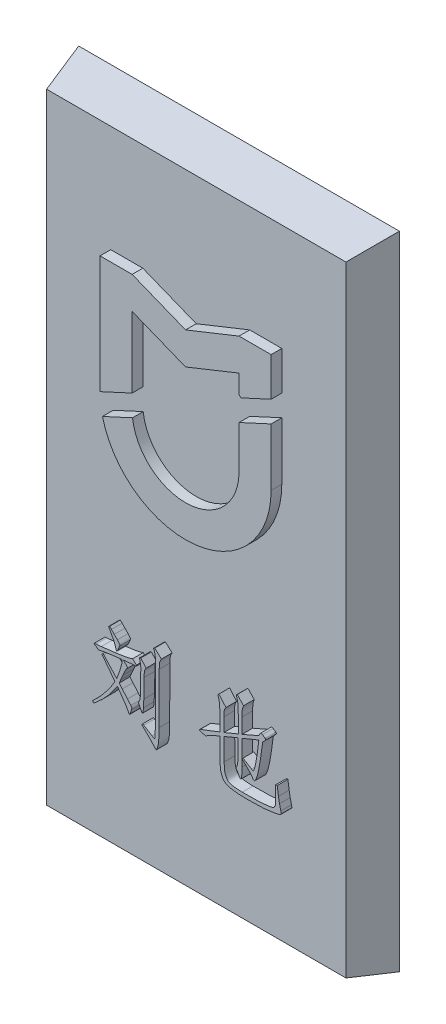
from build123d import *

# Parameters (mm, degrees)
EXTRUDE_2_DEPTH     = 1
EXTRUDE_3_DEPTH     = 1
SKETCH_5_R          = 5.5
CUT_EXTRUDE_1_DEPTH = 2
EXTRUDE_4_DEPTH     = 1


with BuildPart() as part:
    # 草图1 → 放样1 section 0
    with BuildSketch(Plane.XY):
        with BuildLine():
            Line((-15, -30), (15, -30))
            Line((15, -30), (15, 30))
            Line((15, 30), (-15, 30))
            Line((-15, 30), (-15, -30))
        make_face()
    # 草图2 → 放样1 section 1
    with BuildSketch(Plane.XY.offset(4)):
        with BuildLine():
            Line((-14, -29), (14, -29))
            Line((14, -29), (14, 29))
            Line((14, 29), (-14, 29))
            Line((-14, 29), (-14, -29))
        make_face()
    loft()

    # 草图3 → 凸台-拉伸2 (add)
    with BuildSketch(Plane.XY.offset(4)):
        with BuildLine():
            ThreePointArc((5, 8), (0.299928667, 3.009003827), (-4.964017118, 7.401222869))
            Line((-4.964017118, 7.401222869), (-7.772339179, 6.105074225))
            ThreePointArc((-7.772339179, 6.105074225), (0.954276315, 0.057119117), (8, 8))
            Line((8, 8), (8, 13.384615385))
            Line((8, 13.384615385), (5, 12))
            Line((5, 12), (5, 8))
        make_face()
        with BuildLine():
            Line((-5, 9.384615385), (-5, 16))
            Line((-5, 16), (0, 14))
            Line((0, 14), (5, 16))
            Line((5, 16), (5, 14.244997998))
            ThreePointArc((5, 14.244997998), (5.095728124, 14.167135063), (5.190243902, 14.087804878))
            Line((5.190243902, 14.087804878), (8, 15.384615385))
            Line((8, 15.384615385), (8, 19))
            Line((8, 19), (5, 19))
            Line((5, 19), (0, 17))
            Line((0, 17), (-5, 19))
            Line((-5, 19), (-8, 19))
            Line((-8, 19), (-8, 8))
            Line((-8, 8), (-5, 9.384615385))
        make_face()
    extrude(amount=EXTRUDE_2_DEPTH)

    # 草图4 → 凸台-拉伸3 (add)
    with BuildSketch(Plane.XY.offset(4)):
        with BuildLine():
            Line((-8.701981675, -17.388663968), (-8.617600682, -17.301725975))
            add(Edge.make_bspline(
                [(-8.617600682, -17.301725975), (-8.6150409, -17.299171838), (-8.607361553, -17.291509428), (-8.591939025, -17.275812111), (-8.567531532, -17.253359072), (-8.535647603, -17.222146979), (-8.494553267, -17.183979196), (-8.445204463, -17.138285053), (-8.386816782, -17.085481715), (-8.320576955, -17.024306793), (-8.246221878, -16.954193648), (-8.165436054, -16.873388622), (-8.079020214, -16.781225902), (-7.985588416, -16.679014982), (-7.886121691, -16.565894731), (-7.778094687, -16.443997551), (-7.666436292, -16.308719395), (-7.503591424, -16.115000087), (-7.298895179, -15.854174622), (-7.06301416, -15.517669226), (-6.830626913, -15.160132218), (-6.685534688, -14.909472229), (-6.611634349, -14.781802685)],
                knots=[0, 0, 0, 0, 0.067064899, 0.201194698, 0.408053647, 0.681959008, 1.028641223, 1.448132034, 1.929283414, 2.488604495, 3.120354818, 3.824536261, 4.607279378, 5.463251305, 6.392664243, 7.400870751, 8.483674113, 9.645406679, 12.094487374, 14.629448405, 17.264597856, 20, 20, 20, 20], degree=3))
            add(Edge.make_bspline(
                [(-6.611634349, -14.781802685), (-6.677355219, -14.694080325), (-6.801336137, -14.528594101), (-6.975046697, -14.293869871), (-7.128052851, -14.089741633), (-7.260480444, -13.915569528), (-7.369897523, -13.770279599), (-7.457376329, -13.654282983), (-7.526217285, -13.570571896), (-7.582699071, -13.497799136), (-7.635586412, -13.437186854), (-7.679234592, -13.378243521), (-7.712283472, -13.338932475), (-7.724576877, -13.315079833), (-7.729043256, -13.306413808)],
                knots=[0, 0, 0, 0, 2.13149326, 4.021013283, 5.678471046, 7.092298062, 8.275727547, 9.215558715, 9.917047241, 10.382981583, 11.006899411, 11.479347563, 11.810839116, 12, 12, 12, 12], degree=3))
            Line((-7.729043256, -13.306413808), (-7.824930748, -13.177285319))
            Line((-7.824930748, -13.177285319), (-7.729043256, -13.073726827))
            Line((-7.729043256, -13.073726827), (-7.644662263, -13.15938632))
            add(Edge.make_bspline(
                [(-7.644662263, -13.15938632), (-7.629282451, -13.175972122), (-7.591954382, -13.216227229), (-7.527305195, -13.288297956), (-7.440557184, -13.379422665), (-7.302378255, -13.536292511), (-7.104572099, -13.745740062), (-6.905065826, -13.963796689), (-6.747802954, -14.136718021), (-6.635049858, -14.252099447), (-6.536865705, -14.358806964), (-6.47286159, -14.423973045), (-6.442872363, -14.454506712)],
                knots=[0, 0, 0, 0, 0.384045172, 0.932109217, 1.643764177, 2.519898478, 4.481024401, 6.534588103, 7.538259206, 8.449228042, 9.273383417, 10, 10, 10, 10], degree=3))
            add(Edge.make_bspline(
                [(-6.442872363, -14.454506712), (-6.405201527, -14.35911478), (-6.332905522, -14.176043302), (-6.231843181, -13.912276932), (-6.149864716, -13.668866252), (-6.078665366, -13.450308489), (-6.024339358, -13.258168598), (-5.98424666, -13.096326335), (-5.956943752, -12.966798323), (-5.95252254, -12.890132643), (-5.950649904, -12.857660345)],
                knots=[0, 0, 0, 0, 1.468618142, 2.818499293, 4.043910366, 5.145864078, 6.10981738, 6.901638294, 7.534781031, 8, 8, 8, 8], degree=3))
            Line((-5.950649904, -12.857660345), (-5.950649904, -12.667163861))
            Line((-5.950649904, -12.667163861), (-6.972171319, -12.788621351))
            Line((-6.972171319, -12.788621351), (-7.451608779, -12.857660345))
            Line((-7.451608779, -12.857660345), (-7.956616237, -12.952269337))
            Line((-7.956616237, -12.952269337), (-8.16117622, -12.995738334))
            Line((-8.16117622, -12.995738334), (-8.232772214, -12.935648839))
            Line((-8.232772214, -12.935648839), (-8.485915193, -12.745152355))
            add(Edge.make_bspline(
                [(-8.485915193, -12.745152355), (-8.501489303, -12.73490888), (-8.526447886, -12.718493008), (-8.558458879, -12.694799587), (-8.557568147, -12.661889169), (-8.50827822, -12.649271695), (-8.449453901, -12.63496461), (-8.393937078, -12.628338983), (-8.365736203, -12.624973365)],
                knots=[0, 0, 0, 0, 1.118768377, 1.792903396, 2.169548065, 2.763492425, 4.355951528, 6, 6, 6, 6], degree=3))
            Line((-8.365736203, -12.624973365), (-7.885020243, -12.590453867))
            add(Edge.make_bspline(
                [(-7.885020243, -12.590453867), (-7.78272737, -12.578629672), (-7.574258285, -12.5545324), (-7.256024754, -12.515654208), (-6.925643087, -12.476441077), (-6.701543082, -12.448642762), (-6.587342851, -12.43447688)],
                knots=[0, 0, 0, 0, 0.945420497, 1.926731945, 2.943473063, 4, 4, 4, 4], degree=3))
            add(Edge.make_bspline(
                [(-6.587342851, -12.43447688), (-6.495657729, -12.423413493), (-6.318882537, -12.402082524), (-6.064664904, -12.364158296), (-5.830515798, -12.327688901), (-5.617264447, -12.28984122), (-5.424834911, -12.249462361), (-5.25244094, -12.211336739), (-5.101225844, -12.169009917), (-5.008293553, -12.13818563), (-4.964926486, -12.123801406)],
                knots=[0, 0, 0, 0, 1.33948248, 2.582613925, 3.727962399, 4.776813962, 5.723648299, 6.579883267, 7.337299279, 8, 8, 8, 8], degree=3))
            Line((-4.964926486, -12.123801406), (-4.592883017, -12.44342638))
            add(Edge.make_bspline(
                [(-4.592883017, -12.44342638), (-4.586313661, -12.454610374), (-4.573704208, -12.476077324), (-4.578676747, -12.511884126), (-4.596688819, -12.541911053), (-4.618071593, -12.545302265), (-4.628681014, -12.546984871)],
                knots=[0, 0, 0, 0, 1.123791349, 2.157044512, 3.08558681, 4, 4, 4, 4], degree=3))
            Line((-4.628681014, -12.546984871), (-5.193777967, -12.590453867))
            Line((-5.193777967, -12.590453867), (-5.793394417, -12.650543362))
            Line((-5.793394417, -12.650543362), (-5.409844449, -13.099296825))
            add(Edge.make_bspline(
                [(-5.409844449, -13.099296825), (-5.449499903, -13.136079122), (-5.524000558, -13.205181979), (-5.587303376, -13.301744233), (-5.61998484, -13.37159487), (-5.641445696, -13.416701743), (-5.666890063, -13.471734749), (-5.696865722, -13.536256466), (-5.729756683, -13.61142488), (-5.766306518, -13.697074488), (-5.809177744, -13.791622756), (-5.838230924, -13.858260359), (-5.853483912, -13.893245259)],
                knots=[0, 0, 0, 0, 1.762639404, 3.311468555, 3.728776672, 4.283189535, 4.943599157, 5.710021754, 6.607881863, 7.624557154, 8.752886879, 10, 10, 10, 10], degree=3))
            Line((-5.853483912, -13.893245259), (-6.082335393, -14.411037716))
            Line((-6.082335393, -14.411037716), (-6.214020882, -14.712763691))
            Line((-6.214020882, -14.712763691), (-5.926358406, -15.049009163))
            Line((-5.926358406, -15.049009163), (-5.434135947, -15.610270616))
            Line((-5.434135947, -15.610270616), (-5.120903473, -15.973364586))
            add(Edge.make_bspline(
                [(-5.120903473, -15.973364586), (-5.108508398, -15.990363114), (-5.086163173, -16.021007216), (-5.056993841, -16.062275096), (-5.040222812, -16.096032898), (-5.029672316, -16.123584455), (-5.031655384, -16.152962114), (-5.034721662, -16.189376311), (-5.04632312, -16.236994653), (-5.055631797, -16.272143528), (-5.060813978, -16.291711059)],
                knots=[0, 0, 0, 0, 1.455215602, 2.623390349, 3.479583614, 4.066449285, 4.626074215, 5.48479686, 6.599775501, 8, 8, 8, 8], degree=3))
            Line((-5.060813978, -16.291711059), (-5.169486469, -16.663754528))
            add(Edge.make_bspline(
                [(-5.169486469, -16.663754528), (-5.174174993, -16.677157718), (-5.18246774, -16.700864381), (-5.198745873, -16.729886481), (-5.216901029, -16.749122095), (-5.238951481, -16.755125572), (-5.261594893, -16.748983909), (-5.282282348, -16.729450325), (-5.305362329, -16.7015698), (-5.3182664, -16.677293999), (-5.325463456, -16.663754528)],
                knots=[0, 0, 0, 0, 1.365122435, 2.414536923, 3.199116316, 3.836643909, 4.513934304, 5.360547298, 6.527884014, 8, 8, 8, 8], degree=3))
            Line((-5.325463456, -16.663754528), (-5.421350948, -16.482207543))
            Line((-5.421350948, -16.482207543), (-5.565821436, -16.215001065))
            add(Edge.make_bspline(
                [(-5.565821436, -16.215001065), (-5.572208548, -16.205622117), (-5.588244401, -16.182074784), (-5.616983427, -16.140250866), (-5.658060685, -16.086621593), (-5.705063521, -16.017726276), (-5.763659301, -15.936783591), (-5.830878889, -15.842211073), (-5.90903839, -15.735248117), (-5.992876265, -15.619552174), (-6.075177782, -15.503789732), (-6.150436469, -15.397555707), (-6.216408063, -15.305904078), (-6.26928579, -15.226623912), (-6.312977006, -15.16243407), (-6.347040873, -15.11293019), (-6.368573488, -15.076247309), (-6.378991259, -15.056277349), (-6.382782868, -15.049009163)],
                knots=[0, 0, 0, 0, 0.382459276, 0.960224421, 1.710024245, 2.658454337, 3.770494442, 5.077894009, 6.569008607, 8.235429148, 9.893471766, 11.356158959, 12.623493842, 13.699131709, 14.567622413, 15.240873571, 15.723711415, 16, 16, 16, 16], degree=3))
            add(Edge.make_bspline(
                [(-6.382782868, -15.049009163), (-6.416909498, -15.100552505), (-6.482944033, -15.200288127), (-6.578062572, -15.345140635), (-6.670026744, -15.477861724), (-6.753098386, -15.60222334), (-6.833596009, -15.714430579), (-6.905249148, -15.8183162), (-6.973635526, -15.91004722), (-7.058115277, -16.023697045), (-7.173217897, -16.167150414), (-7.334311928, -16.346177935), (-7.520572626, -16.54609202), (-7.728276888, -16.75445262), (-7.936900177, -16.959762036), (-8.134192485, -17.142216407), (-8.308601908, -17.29845862), (-8.42121459, -17.389077999), (-8.473130194, -17.430854464)],
                knots=[0, 0, 0, 0, 0.931745548, 1.802914179, 2.611776586, 3.365396291, 4.056858392, 4.693065683, 5.267339538, 5.781210556, 6.827513186, 8.037874439, 9.410316573, 10.945546555, 12.471773758, 13.821678912, 14.99577158, 16, 16, 16, 16], degree=3))
            Line((-8.473130194, -17.430854464), (-8.606094183, -17.534412955))
            Line((-8.606094183, -17.534412955), (-8.701981675, -17.388663968))
        make_face()
        with BuildLine():
            Line((-7.211250799, -10.630513531), (-7.103856808, -10.553803537))
            Line((-7.103856808, -10.553803537), (-6.935094822, -10.726401023))
            Line((-6.935094822, -10.726401023), (-6.671723844, -10.993607501))
            Line((-6.671723844, -10.993607501), (-6.382782868, -11.295333475))
            add(Edge.make_bspline(
                [(-6.382782868, -11.295333475), (-6.364016122, -11.315776091), (-6.328925502, -11.354000303), (-6.279962873, -11.407778928), (-6.238808393, -11.454933426), (-6.206100395, -11.495820497), (-6.179781755, -11.528336484), (-6.163263547, -11.554924513), (-6.151359602, -11.573453422), (-6.145792904, -11.602262853), (-6.166926085, -11.650051026), (-6.181777032, -11.692273105), (-6.191007884, -11.71851694)],
                knots=[0, 0, 0, 0, 1.619185606, 3.027601398, 4.244025609, 5.269295413, 6.084975465, 6.67813271, 7.10086228, 7.354451259, 8.355615234, 10, 10, 10, 10], degree=3))
            Line((-6.191007884, -11.71851694), (-6.311186874, -12.029192414))
            add(Edge.make_bspline(
                [(-6.311186874, -12.029192414), (-6.321417975, -12.053246865), (-6.339637715, -12.096083488), (-6.369175367, -12.150574851), (-6.394959287, -12.188922038), (-6.420692917, -12.212351984), (-6.449964905, -12.215095714), (-6.472643068, -12.194654532), (-6.489438739, -12.160245395), (-6.497947711, -12.131683057), (-6.502961858, -12.114851907)],
                knots=[0, 0, 0, 0, 1.766026744, 3.144973943, 4.176047435, 4.895969722, 5.415113065, 5.991050895, 6.816171035, 8, 8, 8, 8], degree=3))
            Line((-6.502961858, -12.114851907), (-6.527253356, -12.029192414))
            add(Edge.make_bspline(
                [(-6.527253356, -12.029192414), (-6.565462786, -11.913018959), (-6.64149182, -11.681857287), (-6.749621634, -11.463861832), (-6.803409333, -11.35542297)],
                knots=[0, 0, 0, 0, 1.005127315, 2, 2, 2, 2], degree=3))
            Line((-6.803409333, -11.35542297), (-6.972171319, -11.053696996))
            add(Edge.make_bspline(
                [(-6.972171319, -11.053696996), (-6.993300524, -11.01673679), (-7.030051629, -10.952450019), (-7.07406915, -10.869103457), (-7.103723446, -10.815099763), (-7.112566488, -10.786565613), (-7.115363307, -10.777541019)],
                knots=[0, 0, 0, 0, 1.639141311, 2.851042099, 3.636615117, 4, 4, 4, 4], degree=3))
            Line((-7.115363307, -10.777541019), (-7.211250799, -10.630513531))
        make_face()
        with BuildLine():
            Line((-4.31544854, -11.727466439), (-4.19526955, -11.675047944))
            Line((-4.19526955, -11.675047944), (-3.691540592, -12.245258896))
            add(Edge.make_bspline(
                [(-3.691540592, -12.245258896), (-3.709810323, -12.2727357), (-3.743306609, -12.323112515), (-3.783569559, -12.394330478), (-3.813704395, -12.452101199), (-3.834694025, -12.516023227), (-3.847448468, -12.59699214), (-3.86001522, -12.684347934), (-3.866041286, -12.771519098), (-3.870153354, -12.858037951), (-3.87038165, -12.963355521), (-3.871309223, -13.040061953), (-3.871809077, -13.081397827)],
                knots=[0, 0, 0, 0, 1.131244594, 2.0740586, 2.806258543, 3.36096166, 4.37296763, 5.611338802, 6.388280779, 7.368648685, 8.582006723, 10, 10, 10, 10], degree=3))
            Line((-3.871809077, -13.081397827), (-3.907607074, -14.859791178))
            Line((-3.907607074, -14.859791178), (-3.943405071, -15.584700618))
            add(Edge.make_bspline(
                [(-3.943405071, -15.584700618), (-3.945337151, -15.617956796), (-3.948981312, -15.680682431), (-3.95706597, -15.768414138), (-3.964171003, -15.844825772), (-3.973350685, -15.90913213), (-3.981514107, -15.961795872), (-3.991691865, -16.002621639), (-4.002479425, -16.031402593), (-4.01557264, -16.054962993), (-4.04649104, -16.064029303), (-4.079703401, -16.034802266), (-4.114163474, -15.988274594), (-4.135459361, -15.945855862), (-4.147965054, -15.92094609)],
                knots=[0, 0, 0, 0, 1.76302463, 3.325302124, 4.663004508, 5.824175704, 6.762377734, 7.484540761, 8.041647273, 8.39829817, 8.869293458, 9.507688602, 10.536427081, 12, 12, 12, 12], degree=3))
            Line((-4.147965054, -15.92094609), (-4.255359045, -15.713829107))
            Line((-4.255359045, -15.713829107), (-4.352525037, -15.532282122))
            add(Edge.make_bspline(
                [(-4.352525037, -15.532282122), (-4.365405618, -15.507749536), (-4.386757968, -15.467081464), (-4.402824564, -15.412835847), (-4.395966719, -15.373877463), (-4.383846398, -15.34036551), (-4.365738625, -15.298101457), (-4.326896416, -15.231664451), (-4.282712631, -15.130473075), (-4.25294185, -14.987201603), (-4.235786887, -14.823160753), (-4.233540193, -14.705998092), (-4.232346047, -14.643724696)],
                knots=[0, 0, 0, 0, 0.901925096, 1.495136018, 1.774437093, 2.167492218, 2.649873968, 3.26160492, 4.659748266, 6.204185153, 7.982477734, 10, 10, 10, 10], degree=3))
            Line((-4.232346047, -14.643724696), (-4.19526955, -12.814191349))
            Line((-4.19526955, -12.814191349), (-4.183763051, -12.44342638))
            add(Edge.make_bspline(
                [(-4.183763051, -12.44342638), (-4.18831572, -12.402924774), (-4.198826597, -12.309417557), (-4.215744817, -12.184916485), (-4.235127336, -12.066005847), (-4.255291323, -11.96181072), (-4.282481032, -11.84759475), (-4.304121749, -11.768739449), (-4.31544854, -11.727466439)],
                knots=[0, 0, 0, 0, 1.006347927, 2.323384265, 3.101860361, 3.981004873, 4.943254252, 6, 6, 6, 6], degree=3))
        make_face()
        with BuildLine():
            Line((-2.886085659, -10.216279565), (-2.260899212, -10.795440017))
            add(Edge.make_bspline(
                [(-2.260899212, -10.795440017), (-2.27897721, -10.825593177), (-2.31186996, -10.88045657), (-2.353740762, -10.955684025), (-2.385079585, -11.013972945), (-2.406156719, -11.061201132), (-2.418307524, -11.107926684), (-2.429878104, -11.162874149), (-2.439530387, -11.231674601), (-2.451791638, -11.345356064), (-2.462447745, -11.509089806), (-2.464411029, -11.645623695), (-2.465459195, -11.71851694)],
                knots=[0, 0, 0, 0, 1.09355359, 1.989710599, 2.677512757, 3.152714002, 3.593377568, 4.175755165, 4.899414449, 5.752884475, 7.732533383, 10, 10, 10, 10], degree=3))
            Line((-2.465459195, -11.71851694), (-2.489750693, -16.464308545))
            add(Edge.make_bspline(
                [(-2.489750693, -16.464308545), (-2.489682191, -16.492009645), (-2.489529374, -16.553807072), (-2.490975351, -16.656519076), (-2.4938808, -16.778813349), (-2.496965577, -16.96890006), (-2.502164021, -17.223356379), (-2.509750918, -17.482641294), (-2.523924139, -17.690403365), (-2.543112578, -17.841690607), (-2.577602355, -17.986608757), (-2.61808336, -18.120197835), (-2.659407718, -18.233941254), (-2.695694125, -18.314965002), (-2.715146911, -18.36969669), (-2.735761473, -18.38529897), (-2.741615172, -18.389729384)],
                knots=[0, 0, 0, 0, 0.591697287, 1.319996994, 2.194077997, 3.204678908, 5.380780365, 7.630722164, 8.744310266, 9.828297922, 10.883818306, 11.920525732, 12.813365975, 13.454079988, 13.844980897, 14, 14, 14, 14], degree=3))
            add(Edge.make_bspline(
                [(-2.741615172, -18.389729384), (-2.748580604, -18.386552763), (-2.770203473, -18.376691542), (-2.805730246, -18.342781364), (-2.857676356, -18.290296374), (-2.898439287, -18.248716896), (-2.921883657, -18.224802898)],
                knots=[0, 0, 0, 0, 0.372665578, 1.156869871, 2.364803703, 4, 4, 4, 4], degree=3))
            Line((-2.921883657, -18.224802898), (-3.35529512, -17.750479437))
            Line((-3.35529512, -17.750479437), (-3.967696569, -17.154698487))
            Line((-3.967696569, -17.154698487), (-4.099382058, -17.008949499))
            Line((-4.099382058, -17.008949499), (-4.003494566, -16.905391008))
            Line((-4.003494566, -16.905391008), (-3.907607074, -16.974430002))
            Line((-3.907607074, -16.974430002), (-3.137950139, -17.448753463))
            add(Edge.make_bspline(
                [(-3.137950139, -17.448753463), (-3.107846641, -17.467453432), (-3.055614578, -17.499899429), (-2.987095797, -17.54194895), (-2.943047018, -17.562424533), (-2.912447329, -17.578564787), (-2.894380813, -17.563642034), (-2.884389813, -17.541037572), (-2.870955086, -17.507974371), (-2.865124564, -17.480861102), (-2.861794162, -17.465373961)],
                knots=[0, 0, 0, 0, 2.231975484, 3.872662471, 4.948167798, 5.447359977, 5.773533116, 6.264068126, 7.008433082, 8, 8, 8, 8], degree=3))
            add(Edge.make_bspline(
                [(-2.861794162, -17.465373961), (-2.858514906, -17.447512726), (-2.850750002, -17.405219364), (-2.858581596, -17.328530112), (-2.859413733, -17.227473124), (-2.851781312, -17.137658333), (-2.847727937, -17.0638988), (-2.843092015, -17.012428916), (-2.84163978, -16.949676316), (-2.836799089, -16.876886425), (-2.834870732, -16.792882265), (-2.832612814, -16.698680605), (-2.827953876, -16.593893276), (-2.826668572, -16.520567804), (-2.825996165, -16.482207543)],
                knots=[0, 0, 0, 0, 0.661127957, 1.565475392, 2.796625909, 4.357721855, 4.857348772, 5.497957161, 6.246587067, 7.151605532, 8.164975693, 9.318533995, 10.597189571, 12, 12, 12, 12], degree=3))
            Line((-2.825996165, -16.482207543), (-2.801704667, -11.545919455))
            add(Edge.make_bspline(
                [(-2.801704667, -11.545919455), (-2.801760094, -11.519481806), (-2.801871949, -11.466129504), (-2.807924708, -11.396797206), (-2.810607971, -11.332810947), (-2.815391131, -11.270252602), (-2.816801137, -11.193025953), (-2.822487079, -11.073272995), (-2.829012882, -10.921239192), (-2.843980556, -10.769848285), (-2.868264302, -10.646533474), (-2.89965208, -10.540449213), (-2.942670187, -10.417885881), (-2.976551583, -10.331655482), (-2.99475815, -10.28531856)],
                knots=[0, 0, 0, 0, 0.739991118, 1.493333668, 1.947445289, 2.533295858, 3.249720848, 4.109699155, 5.890394751, 7.51137051, 8.363279193, 9.405830689, 10.605992517, 12, 12, 12, 12], degree=3))
            Line((-2.99475815, -10.28531856), (-2.886085659, -10.216279565))
        make_face()
        with BuildLine():
            Line((3.210824632, -13.962284253), (3.210824632, -12.374387385))
            add(Edge.make_bspline(
                [(3.210824632, -12.374387385), (3.209126434, -12.271656981), (3.205655579, -12.06169196), (3.187606357, -11.795820456), (3.159876337, -11.575337912), (3.126662955, -11.402164237), (3.07905803, -11.224205556), (3.038507103, -11.105465778), (3.017771149, -11.044747496)],
                knots=[0, 0, 0, 0, 1.368881025, 2.797780605, 3.547867927, 4.328518173, 5.145277974, 6, 6, 6, 6], degree=3))
            Line((3.017771149, -11.044747496), (3.11493714, -10.941189005))
            Line((3.11493714, -10.941189005), (3.774643085, -11.700617942))
            add(Edge.make_bspline(
                [(3.774643085, -11.700617942), (3.758326503, -11.725251518), (3.72796582, -11.771087843), (3.687480246, -11.836093473), (3.657878594, -11.893945094), (3.627944587, -11.964767706), (3.607082509, -12.067445774), (3.592483254, -12.208639878), (3.584038135, -12.372591178), (3.583265573, -12.487741703), (3.582868101, -12.546984871)],
                knots=[0, 0, 0, 0, 0.799333978, 1.487341208, 2.069922442, 2.555870397, 3.562491356, 4.885176502, 6.397471374, 8, 8, 8, 8], degree=3))
            Line((3.582868101, -12.546984871), (3.582868101, -13.824206265))
            Line((3.582868101, -13.824206265), (4.929128489, -13.262944811))
            Line((4.929128489, -13.262944811), (4.929128489, -11.753036437))
            add(Edge.make_bspline(
                [(4.929128489, -11.753036437), (4.92858556, -11.691244836), (4.927548375, -11.573201294), (4.927892338, -11.404804507), (4.921425798, -11.253992254), (4.915833818, -11.079927224), (4.901987045, -10.885380488), (4.875754526, -10.70123617), (4.846282377, -10.559098647), (4.815991848, -10.44684633), (4.781186889, -10.325153143), (4.751489744, -10.242540414), (4.736075005, -10.199659067)],
                knots=[0, 0, 0, 0, 1.176911092, 2.248311282, 3.206600744, 4.051334116, 5.565261425, 6.918565952, 7.590320494, 8.328559244, 9.132414199, 10, 10, 10, 10], degree=3))
            Line((4.736075005, -10.199659067), (4.831962497, -10.112721074))
            Line((4.831962497, -10.112721074), (5.421350948, -10.734072022))
            add(Edge.make_bspline(
                [(5.421350948, -10.734072022), (5.408322526, -10.770211237), (5.383317544, -10.839571927), (5.351239432, -10.940628433), (5.325704556, -11.034024238), (5.303827308, -11.126182054), (5.29141719, -11.231984471), (5.283519325, -11.364266474), (5.276614903, -11.530086504), (5.276786754, -11.652026137), (5.27688046, -11.71851694)],
                knots=[0, 0, 0, 0, 0.919393691, 1.76455914, 2.536580374, 3.236881176, 4.028858006, 5.081856361, 6.408805183, 8, 8, 8, 8], degree=3))
            Line((5.27688046, -11.71851694), (5.27688046, -13.124866823))
            Line((5.27688046, -13.124866823), (6.827700831, -12.452375879))
            Line((6.827700831, -12.452375879), (7.019475815, -12.158320903))
            add(Edge.make_bspline(
                [(7.019475815, -12.158320903), (7.026703946, -12.148697104), (7.041507275, -12.128987408), (7.086030215, -12.128122667), (7.134752872, -12.147887327), (7.168626298, -12.170689347), (7.188237801, -12.183890901)],
                knots=[0, 0, 0, 0, 0.71453755, 1.463384476, 2.53139035, 4, 4, 4, 4], degree=3))
            Line((7.188237801, -12.183890901), (7.44010228, -12.374387385))
            add(Edge.make_bspline(
                [(7.44010228, -12.374387385), (7.456409708, -12.388950822), (7.484511329, -12.414047126), (7.499338251, -12.463386598), (7.482078066, -12.498937399), (7.458599113, -12.532898791), (7.416909429, -12.570821509), (7.368574387, -12.61700621), (7.316558293, -12.66066125), (7.273659526, -12.702873709), (7.241348343, -12.736242921), (7.21701738, -12.763028278), (7.208110051, -12.796607746), (7.197737652, -12.840710682), (7.1853454, -12.906928354), (7.171491916, -12.995155013), (7.156693918, -13.104841442), (7.138517192, -13.236055278), (7.117949326, -13.388985313), (7.090185505, -13.615805341), (7.057078191, -13.895783521), (7.012200307, -14.20829562), (6.973202819, -14.482784302), (6.930564858, -14.72147271), (6.891685116, -14.932838148), (6.854222441, -15.124032539), (6.8204412, -15.299942354), (6.785589875, -15.460139588), (6.75147321, -15.607093542), (6.714601925, -15.742081558), (6.673630702, -15.866106051), (6.630965981, -15.977511831), (6.590073801, -16.073390324), (6.556322534, -16.151155796), (6.52798116, -16.209509469), (6.502502392, -16.25649485), (6.470291137, -16.298824211), (6.434831686, -16.300083455), (6.418580865, -16.300660558)],
                knots=[0, 0, 0, 0, 0.559111769, 0.963484084, 1.199679221, 1.54642562, 2.027141703, 2.640108529, 3.269336219, 3.773372396, 4.184380251, 4.473866774, 4.681914613, 5.06490853, 5.645540527, 6.411685309, 7.363818343, 8.492742829, 9.820197465, 11.333935145, 14.372292433, 17.073622702, 19.457084914, 21.504944609, 23.311490023, 24.986709407, 26.517821523, 27.920066707, 29.204667356, 30.399106788, 31.519103026, 32.563782659, 33.467986644, 34.199448975, 34.748689143, 35.126785844, 35.59981199, 36, 36, 36, 36], degree=3))
            add(Edge.make_bspline(
                [(6.418580865, -16.300660558), (6.409816095, -16.299120895), (6.389730733, -16.2955926), (6.361018096, -16.272946221), (6.329957172, -16.239895489), (6.309607694, -16.212298734), (6.298401875, -16.197102067)],
                knots=[0, 0, 0, 0, 0.646680353, 1.481933883, 2.613379931, 4, 4, 4, 4], degree=3))
            Line((6.298401875, -16.197102067), (5.973662902, -15.791817601))
            Line((5.973662902, -15.791817601), (5.613125932, -15.421052632))
            Line((5.613125932, -15.421052632), (5.301171958, -15.126997656))
            Line((5.301171958, -15.126997656), (5.372767952, -14.997869167))
            Line((5.372767952, -14.997869167), (6.178222885, -15.490091626))
            add(Edge.make_bspline(
                [(6.178222885, -15.490091626), (6.194648608, -15.501452728), (6.223636396, -15.521502575), (6.263939359, -15.544300169), (6.292140741, -15.559916984), (6.316588627, -15.565606088), (6.337826073, -15.551900936), (6.356216812, -15.525312045), (6.377768277, -15.484375663), (6.405013145, -15.426588416), (6.435086831, -15.342078206), (6.466498512, -15.224546279), (6.505581258, -15.071791979), (6.559629335, -14.822391743), (6.627938588, -14.494438642), (6.679128713, -14.166876704), (6.712451994, -13.922564919), (6.736216622, -13.763771542), (6.754851776, -13.626833399), (6.773152012, -13.502512968), (6.791650807, -13.370998623), (6.808587871, -13.212279497), (6.829172257, -13.017111291), (6.843144072, -12.874717856), (6.850713829, -12.79757085)],
                knots=[0, 0, 0, 0, 0.440323242, 0.777073662, 1.016577932, 1.15873692, 1.297439592, 1.538046727, 1.870179391, 2.315683085, 2.945720451, 3.843830757, 4.996709113, 6.421182702, 9.468416178, 12.379641864, 13.726774567, 14.903855726, 15.918856624, 16.773102867, 17.673862327, 18.846135373, 20.291275087, 22, 22, 22, 22], degree=3))
            Line((6.850713829, -12.79757085), (5.265373961, -13.444491796))
            Line((5.265373961, -13.444491796), (5.265373961, -15.791817601))
            add(Edge.make_bspline(
                [(5.265373961, -15.791817601), (5.265651609, -15.854466389), (5.266174824, -15.972525423), (5.262737996, -16.139142222), (5.260821378, -16.284490155), (5.256968943, -16.408939518), (5.252241525, -16.512134297), (5.245890952, -16.594396297), (5.239366722, -16.655676085), (5.228165992, -16.706277228), (5.212924944, -16.748283526), (5.195840814, -16.782707572), (5.178343387, -16.807366528), (5.163005445, -16.808881042), (5.15670147, -16.809503516)],
                knots=[0, 0, 0, 0, 2.150659061, 4.052827516, 5.720942216, 7.140763154, 8.327264278, 9.266458778, 9.974179908, 10.439139188, 11.045371919, 11.490336149, 11.790525499, 12, 12, 12, 12], degree=3))
            add(Edge.make_bspline(
                [(5.15670147, -16.809503516), (5.145084644, -16.806090327), (5.115477873, -16.797391438), (5.079860637, -16.750467384), (5.03411576, -16.687163889), (5.00555075, -16.633226562), (4.989217984, -16.602386533)],
                knots=[0, 0, 0, 0, 0.521855015, 1.330005405, 2.473363152, 4, 4, 4, 4], degree=3))
            Line((4.989217984, -16.602386533), (4.831962497, -16.318559557))
            add(Edge.make_bspline(
                [(4.831962497, -16.318559557), (4.816647756, -16.292605327), (4.789719584, -16.24696956), (4.754513798, -16.187356703), (4.736850566, -16.14424678), (4.726676087, -16.112382083), (4.737698822, -16.086419896), (4.74847026, -16.055251845), (4.766358044, -16.014895421), (4.792389019, -15.966324018), (4.818368235, -15.903962994), (4.840282152, -15.826694947), (4.859466062, -15.734353684), (4.874221519, -15.632559334), (4.888087211, -15.531143226), (4.897628983, -15.441089287), (4.906229205, -15.367479809), (4.910466321, -15.300917129), (4.912987062, -15.222899108), (4.915654365, -15.115933767), (4.916598437, -14.970595453), (4.916435041, -14.861069343), (4.91634349, -14.799701683)],
                knots=[0, 0, 0, 0, 1.153316831, 2.027896723, 2.626604535, 2.958707876, 3.24723816, 3.664596661, 4.233327129, 4.925102638, 5.771803346, 6.807388563, 7.988979107, 9.373009111, 10.736290758, 11.899678417, 12.832920397, 13.567268629, 14.447137605, 15.815272531, 17.655290347, 20, 20, 20, 20], degree=3))
            Line((4.91634349, -14.799701683), (4.91634349, -13.582569785))
            Line((4.91634349, -13.582569785), (3.5943746, -14.134881739))
            Line((3.5943746, -14.134881739), (3.607159599, -16.188152568))
            add(Edge.make_bspline(
                [(3.607159599, -16.188152568), (3.609155134, -16.284053774), (3.613328035, -16.484594624), (3.628018181, -16.739684973), (3.658403283, -16.954775715), (3.708894856, -17.120409554), (3.779909349, -17.287863294), (3.8493934, -17.431707783), (3.937255351, -17.541708253), (4.041768254, -17.608686369), (4.174288903, -17.66793349), (4.339417769, -17.712353392), (4.53435378, -17.751593078), (4.762088112, -17.774427082), (5.02090097, -17.7920111), (5.204392162, -17.793279457), (5.301171958, -17.793948434)],
                knots=[0, 0, 0, 0, 1.425456696, 2.980799826, 3.795017339, 4.646697254, 5.544056949, 6.498866747, 7.011340332, 7.612152063, 8.320781704, 9.164607943, 10.145811148, 11.273905285, 12.562160463, 14, 14, 14, 14], degree=3))
            add(Edge.make_bspline(
                [(5.301171958, -17.793948434), (5.470789115, -17.794515515), (5.804503094, -17.79563122), (6.297213468, -17.787554868), (6.774213208, -17.772892278), (7.15857007, -17.752473046), (7.447605944, -17.73307115), (7.6382032, -17.714011088), (7.8043043, -17.691920919), (7.945776182, -17.664672643), (8.063545394, -17.637033396), (8.156964339, -17.603728141), (8.228035826, -17.569073121), (8.286855914, -17.514670336), (8.330260992, -17.44272668), (8.374041165, -17.363231496), (8.402674496, -17.284695978), (8.409655582, -17.232450653), (8.413040699, -17.207116983)],
                knots=[0, 0, 0, 0, 2.420504351, 4.762231322, 7.03186758, 9.2303889, 10.254712443, 11.165461446, 11.963621161, 12.644686658, 13.221420043, 13.686975695, 14.059747789, 14.339570671, 14.816933281, 15.24945927, 15.636064052, 16, 16, 16, 16], degree=3))
            Line((8.413040699, -17.207116983), (8.425825698, -15.635840614))
            Line((8.425825698, -15.635840614), (8.569017686, -15.619220115))
            Line((8.569017686, -15.619220115), (8.689196676, -16.438738547))
            Line((8.689196676, -16.438738547), (8.786362668, -16.991050501))
            Line((8.786362668, -16.991050501), (8.906541658, -17.508842958))
            add(Edge.make_bspline(
                [(8.906541658, -17.508842958), (8.908298872, -17.526376634), (8.912419079, -17.567488534), (8.928010183, -17.628304071), (8.946344796, -17.68162792), (8.951917027, -17.713778718), (8.953846154, -17.72490944)],
                knots=[0, 0, 0, 0, 0.953220718, 2.235054002, 3.388969388, 4, 4, 4, 4], degree=3))
            add(Edge.make_bspline(
                [(8.953846154, -17.72490944), (8.950069463, -17.736983143), (8.941712863, -17.763698363), (8.904645101, -17.795045339), (8.856434737, -17.82724415), (8.789371367, -17.855267017), (8.707715764, -17.884867177), (8.608460275, -17.912549262), (8.492372402, -17.939047729), (8.317130483, -17.971835273), (8.091894188, -18.009785756), (7.825098208, -18.045368552), (7.569274082, -18.078985841), (7.359310107, -18.098316431), (7.186183001, -18.110551033), (7.041252135, -18.117909869), (6.879727276, -18.124408997), (6.70198161, -18.128874983), (6.507684288, -18.134990279), (6.29669265, -18.136283727), (6.069134417, -18.139943667), (5.911870583, -18.139416346), (5.830470914, -18.139143405)],
                knots=[0, 0, 0, 0, 0.232926519, 0.515391414, 0.878795428, 1.325768791, 1.869100865, 2.508894764, 3.255029941, 4.101143149, 5.850638678, 7.536402802, 9.14670046, 10.687374927, 11.488261288, 12.400303648, 13.407749454, 14.51872378, 15.733519881, 17.051853478, 18.474041082, 20, 20, 20, 20], degree=3))
            add(Edge.make_bspline(
                [(5.830470914, -18.139143405), (5.749499846, -18.139378112), (5.591382586, -18.13983644), (5.360320443, -18.136582645), (5.141722252, -18.126795164), (4.935319262, -18.116184546), (4.741261185, -18.099891372), (4.559842862, -18.07740414), (4.390691678, -18.054235165), (4.234594957, -18.024596436), (4.091014932, -17.991286754), (3.960984602, -17.94893976), (3.843915713, -17.899325014), (3.74012297, -17.84200252), (3.649680107, -17.778015545), (3.572517953, -17.706759318), (3.509301087, -17.627469309), (3.447456445, -17.513961696), (3.388881158, -17.37449272), (3.328227496, -17.217719964), (3.287009221, -17.074340979), (3.260759296, -16.939508324), (3.249330552, -16.801128193), (3.240759072, -16.64807565), (3.233684411, -16.473317947), (3.233784497, -16.349677339), (3.233837631, -16.28404006)],
                knots=[0, 0, 0, 0, 1.518911959, 2.966074195, 4.334239857, 5.623327299, 6.842892953, 7.986185861, 9.05230548, 10.044787367, 10.965795675, 11.815222499, 12.606695946, 13.347450692, 14.035144098, 14.679960432, 15.31171039, 15.927477056, 17.09794899, 18.147758735, 19.078945764, 19.892674845, 20.719956626, 21.68090022, 22.768855931, 24, 24, 24, 24], degree=3))
            Line((3.233837631, -16.28404006), (3.222331131, -14.289580226))
            add(Edge.make_bspline(
                [(3.222331131, -14.289580226), (3.159695497, -14.315601661), (3.040781697, -14.365003374), (2.871626836, -14.434819669), (2.722994747, -14.499134877), (2.593460017, -14.553589381), (2.484240181, -14.601604607), (2.394031785, -14.640580012), (2.323583949, -14.672308254), (2.254988923, -14.705658648), (2.17860888, -14.74665373), (2.088638186, -14.806853655), (1.989717119, -14.87517737), (1.923522055, -14.927171092), (1.888855743, -14.95440017)],
                knots=[0, 0, 0, 0, 1.631833046, 3.098036258, 4.40260852, 5.528124467, 6.478632526, 7.272971962, 7.892419543, 8.33722278, 9.108053839, 9.975462267, 10.9397509, 12, 12, 12, 12], degree=3))
            Line((1.888855743, -14.95440017), (1.383848285, -14.816322182))
            add(Edge.make_bspline(
                [(1.383848285, -14.816322182), (1.371256566, -14.813541672), (1.349110971, -14.808651471), (1.321910173, -14.794053216), (1.302807026, -14.775950203), (1.297801439, -14.751917852), (1.303225753, -14.727242926), (1.321967909, -14.705700487), (1.34822781, -14.684206509), (1.37110556, -14.674629187), (1.383848285, -14.669294694)],
                knots=[0, 0, 0, 0, 1.286068791, 2.261864203, 3.078608935, 3.825212105, 4.613490036, 5.528387975, 6.623331777, 8, 8, 8, 8], degree=3))
            Line((1.383848285, -14.669294694), (3.210824632, -13.962284253))
        make_face()
    extrude(amount=EXTRUDE_3_DEPTH)

    # 草图5 → 切除-拉伸1 (cut)
    with BuildSketch(Plane(origin=(0, 0, 0), x_dir=(-1, 0, 0), z_dir=(0, 0, -1))):
        with Locations((0, 18)):
            Circle(SKETCH_5_R)
        with Locations((0, -18)):
            Circle(SKETCH_5_R)
        Circle(SKETCH_5_R)
    extrude(amount=-CUT_EXTRUDE_1_DEPTH, mode=Mode.SUBTRACT)

    # 草图7 → 凸台-拉伸4 (add)
    with BuildSketch(Plane.XY.offset(4)):
        with BuildLine():
            Line((3.210824632, -13.962284253), (1.383848285, -14.669294694))
            add(Edge.make_bspline(
                [(1.383848285, -14.669294694), (1.37110556, -14.674629187), (1.34822781, -14.684206509), (1.321967909, -14.705700487), (1.303225753, -14.727242926), (1.297801439, -14.751917852), (1.302807026, -14.775950203), (1.321910173, -14.794053216), (1.349110971, -14.808651471), (1.371256566, -14.813541672), (1.383848285, -14.816322182)],
                knots=[0, 0, 0, 0, 0.172083528, 0.308951503, 0.423313745, 0.521848487, 0.615173883, 0.717266975, 0.839241401, 1, 1, 1, 1], degree=3))
            Line((1.383848285, -14.816322182), (1.888855743, -14.95440017))
            add(Edge.make_bspline(
                [(1.888855743, -14.95440017), (1.923522055, -14.927171092), (1.989717119, -14.87517737), (2.088638186, -14.806853655), (2.17860888, -14.74665373), (2.254988923, -14.705658648), (2.323583949, -14.672308254), (2.394031785, -14.640580012), (2.484240181, -14.601604607), (2.593460017, -14.553589381), (2.722994747, -14.499134877), (2.871626836, -14.434819669), (3.040781697, -14.365003374), (3.159695497, -14.315601661), (3.222331131, -14.289580226)],
                knots=[0, 0, 0, 0, 0.088354092, 0.168711478, 0.240995513, 0.305231435, 0.342298371, 0.393919003, 0.460113956, 0.539322961, 0.633115957, 0.741830312, 0.864013913, 1, 1, 1, 1], degree=3))
            Line((3.222331131, -14.289580226), (3.233837631, -16.28404006))
            add(Edge.make_bspline(
                [(3.233837631, -16.28404006), (3.233784497, -16.349677339), (3.233684411, -16.473317947), (3.240759072, -16.64807565), (3.249330552, -16.801128193), (3.260759296, -16.939508324), (3.287009221, -17.074340979), (3.328227496, -17.217719964), (3.388881158, -17.37449272), (3.447456445, -17.513961696), (3.509301087, -17.627469309), (3.572517953, -17.706759318), (3.649680107, -17.778015545), (3.74012297, -17.84200252), (3.843915713, -17.899325014), (3.960984602, -17.94893976), (4.091014932, -17.991286754), (4.234594957, -18.024596436), (4.390691678, -18.054235165), (4.559842862, -18.07740414), (4.741261185, -18.099891372), (4.935319262, -18.116184546), (5.141722252, -18.126795164), (5.360320443, -18.136582645), (5.591382586, -18.13983644), (5.749499846, -18.139378112), (5.830470914, -18.139143405)],
                knots=[0, 0, 0, 0, 0.05129767, 0.096629158, 0.136668474, 0.171138548, 0.205043927, 0.243843386, 0.287585459, 0.336355123, 0.362012067, 0.388334982, 0.415202329, 0.443856221, 0.474721002, 0.507699063, 0.543091847, 0.581467193, 0.622820605, 0.667242256, 0.71487946, 0.765694696, 0.819406673, 0.876413575, 0.936712002, 1, 1, 1, 1], degree=3))
            add(Edge.make_bspline(
                [(5.830470914, -18.139143405), (5.911870583, -18.139416346), (6.069134417, -18.139943667), (6.29669265, -18.136283727), (6.507684288, -18.134990279), (6.70198161, -18.128874983), (6.879727276, -18.124408997), (7.041252135, -18.117909869), (7.186183001, -18.110551033), (7.359310107, -18.098316431), (7.569274082, -18.078985841), (7.825098208, -18.045368552), (8.091894188, -18.009785756), (8.317130483, -17.971835273), (8.492372402, -17.939047729), (8.608460275, -17.912549262), (8.707715764, -17.884867177), (8.789371367, -17.855267017), (8.856434737, -17.82724415), (8.904645101, -17.795045339), (8.941712863, -17.763698363), (8.950069463, -17.736983143), (8.953846154, -17.72490944)],
                knots=[0, 0, 0, 0, 0.076297946, 0.147407326, 0.213324006, 0.274063811, 0.329612527, 0.379984818, 0.425586936, 0.465631254, 0.542664977, 0.62317986, 0.707468066, 0.794942843, 0.837248503, 0.874555262, 0.906544957, 0.93371156, 0.956060229, 0.974230429, 0.988353674, 1, 1, 1, 1], degree=3))
            add(Edge.make_bspline(
                [(8.953846154, -17.72490944), (8.951917027, -17.713778718), (8.946344796, -17.68162792), (8.928010183, -17.628304071), (8.912419079, -17.567488534), (8.908298872, -17.526376634), (8.906541658, -17.508842958)],
                knots=[0, 0, 0, 0, 0.152757653, 0.4412365, 0.76169482, 1, 1, 1, 1], degree=3))
            Line((8.906541658, -17.508842958), (8.786362668, -16.991050501))
            Line((8.786362668, -16.991050501), (8.689196676, -16.438738547))
            Line((8.689196676, -16.438738547), (8.569017686, -15.619220115))
            Line((8.569017686, -15.619220115), (8.425825698, -15.635840614))
            Line((8.425825698, -15.635840614), (8.413040699, -17.207116983))
            add(Edge.make_bspline(
                [(8.413040699, -17.207116983), (8.409655582, -17.232450653), (8.402674496, -17.284695978), (8.374041165, -17.363231496), (8.330260992, -17.44272668), (8.286855914, -17.514670336), (8.228035826, -17.569073121), (8.156964339, -17.603728141), (8.063545394, -17.637033396), (7.945776182, -17.664672643), (7.8043043, -17.691920919), (7.6382032, -17.714011088), (7.447605944, -17.73307115), (7.15857007, -17.752473046), (6.774213208, -17.772892278), (6.297213468, -17.787554868), (5.804503094, -17.79563122), (5.470789115, -17.794515515), (5.301171958, -17.793948434)],
                knots=[0, 0, 0, 0, 0.022745997, 0.046908796, 0.07394167, 0.103776833, 0.121265763, 0.144564019, 0.173661247, 0.209707084, 0.252273677, 0.30215866, 0.359080472, 0.423100694, 0.560508276, 0.702360542, 0.848718478, 1, 1, 1, 1], degree=3))
            add(Edge.make_bspline(
                [(5.301171958, -17.793948434), (5.204392162, -17.793279457), (5.02090097, -17.7920111), (4.762088112, -17.774427082), (4.53435378, -17.751593078), (4.339417769, -17.712353392), (4.174288903, -17.66793349), (4.041768254, -17.608686369), (3.937255351, -17.541708253), (3.8493934, -17.431707783), (3.779909349, -17.287863294), (3.708894856, -17.120409554), (3.658403283, -16.954775715), (3.628018181, -16.739684973), (3.613328035, -16.484594624), (3.609155134, -16.284053774), (3.607159599, -16.188152568)],
                knots=[0, 0, 0, 0, 0.102702824, 0.194721051, 0.275299204, 0.345385147, 0.40565845, 0.456274853, 0.499189976, 0.535795232, 0.603995932, 0.668093053, 0.728927333, 0.787085727, 0.898181665, 1, 1, 1, 1], degree=3))
            Line((3.607159599, -16.188152568), (3.5943746, -14.134881739))
            Line((3.5943746, -14.134881739), (4.91634349, -13.582569785))
            Line((4.91634349, -13.582569785), (4.91634349, -14.799701683))
            add(Edge.make_bspline(
                [(4.91634349, -14.799701683), (4.916435041, -14.861069343), (4.916598437, -14.970595453), (4.915654365, -15.115933767), (4.912987062, -15.222899108), (4.910466321, -15.300917129), (4.906229205, -15.367479809), (4.897628983, -15.441089287), (4.888087211, -15.531143226), (4.874221519, -15.632559334), (4.859466062, -15.734353684), (4.840282152, -15.826694947), (4.818368235, -15.903962994), (4.792389019, -15.966324018), (4.766358044, -16.014895421), (4.74847026, -16.055251845), (4.737698822, -16.086419896), (4.726676087, -16.112382083), (4.736850566, -16.14424678), (4.754513798, -16.187356703), (4.789719584, -16.24696956), (4.816647756, -16.292605327), (4.831962497, -16.318559557)],
                knots=[0, 0, 0, 0, 0.117235483, 0.209236373, 0.27764312, 0.321636569, 0.35835398, 0.405016079, 0.463185462, 0.531349544, 0.600551045, 0.659630572, 0.711409833, 0.753744868, 0.788333644, 0.816770167, 0.837638092, 0.852064606, 0.868669773, 0.898605164, 0.942334158, 1, 1, 1, 1], degree=3))
            Line((4.831962497, -16.318559557), (4.989217984, -16.602386533))
            add(Edge.make_bspline(
                [(4.989217984, -16.602386533), (5.00555075, -16.633226562), (5.03411576, -16.687163889), (5.079860637, -16.750467384), (5.115477873, -16.797391438), (5.145084644, -16.806090327), (5.15670147, -16.809503516)],
                knots=[0, 0, 0, 0, 0.381659212, 0.667498649, 0.869536246, 1, 1, 1, 1], degree=3))
            add(Edge.make_bspline(
                [(5.15670147, -16.809503516), (5.163005445, -16.808881042), (5.178343387, -16.807366528), (5.195840814, -16.782707572), (5.212924944, -16.748283526), (5.228165992, -16.706277228), (5.239366722, -16.655676085), (5.245890952, -16.594396297), (5.252241525, -16.512134297), (5.256968943, -16.408939518), (5.260821378, -16.284490155), (5.262737996, -16.139142222), (5.266174824, -15.972525423), (5.265651609, -15.854466389), (5.265373961, -15.791817601)],
                knots=[0, 0, 0, 0, 0.017456208, 0.042471988, 0.07955234, 0.130071734, 0.168818341, 0.227795102, 0.30606131, 0.404936404, 0.523254815, 0.662264374, 0.820778412, 1, 1, 1, 1], degree=3))
            Line((5.265373961, -15.791817601), (5.265373961, -13.444491796))
            Line((5.265373961, -13.444491796), (6.850713829, -12.79757085))
            add(Edge.make_bspline(
                [(6.850713829, -12.79757085), (6.843144072, -12.874717856), (6.829172257, -13.017111291), (6.808587871, -13.212279497), (6.791650807, -13.370998623), (6.773152012, -13.502512968), (6.754851776, -13.626833399), (6.736216622, -13.763771542), (6.712451994, -13.922564919), (6.679128713, -14.166876704), (6.627938588, -14.494438642), (6.559629335, -14.822391743), (6.505581258, -15.071791979), (6.466498512, -15.224546279), (6.435086831, -15.342078206), (6.405013145, -15.426588416), (6.377768277, -15.484375663), (6.356216812, -15.525312045), (6.337826073, -15.551900936), (6.316588627, -15.565606088), (6.292140741, -15.559916984), (6.263939359, -15.544300169), (6.223636396, -15.521502575), (6.194648608, -15.501452728), (6.178222885, -15.490091626)],
                knots=[0, 0, 0, 0, 0.077669314, 0.143357483, 0.196642622, 0.237586233, 0.276415608, 0.322552012, 0.376055701, 0.437289006, 0.569617446, 0.708128059, 0.772876858, 0.82528042, 0.866103616, 0.894741678, 0.914991846, 0.930088785, 0.941025473, 0.94733014, 0.953791912, 0.96467847, 0.979985307, 1, 1, 1, 1], degree=3))
            Line((6.178222885, -15.490091626), (5.372767952, -14.997869167))
            Line((5.372767952, -14.997869167), (5.301171958, -15.126997656))
            Line((5.301171958, -15.126997656), (5.613125932, -15.421052632))
            Line((5.613125932, -15.421052632), (5.973662902, -15.791817601))
            Line((5.973662902, -15.791817601), (6.298401875, -16.197102067))
            add(Edge.make_bspline(
                [(6.298401875, -16.197102067), (6.309607694, -16.212298734), (6.329957172, -16.239895489), (6.361018096, -16.272946221), (6.389730733, -16.2955926), (6.409816095, -16.299120895), (6.418580865, -16.300660558)],
                knots=[0, 0, 0, 0, 0.346655017, 0.629516529, 0.838329912, 1, 1, 1, 1], degree=3))
            add(Edge.make_bspline(
                [(6.418580865, -16.300660558), (6.434831686, -16.300083455), (6.470291137, -16.298824211), (6.502502392, -16.25649485), (6.52798116, -16.209509469), (6.556322534, -16.151155796), (6.590073801, -16.073390324), (6.630965981, -15.977511831), (6.673630702, -15.866106051), (6.714601925, -15.742081558), (6.75147321, -15.607093542), (6.785589875, -15.460139588), (6.8204412, -15.299942354), (6.854222441, -15.124032539), (6.891685116, -14.932838148), (6.930564858, -14.72147271), (6.973202819, -14.482784302), (7.012200307, -14.20829562), (7.057078191, -13.895783521), (7.090185505, -13.615805341), (7.117949326, -13.388985313), (7.138517192, -13.236055278), (7.156693918, -13.104841442), (7.171491916, -12.995155013), (7.1853454, -12.906928354), (7.197737652, -12.840710682), (7.208110051, -12.796607746), (7.21701738, -12.763028278), (7.241348343, -12.736242921), (7.273659526, -12.702873709), (7.316558293, -12.66066125), (7.368574387, -12.61700621), (7.416909429, -12.570821509), (7.458599113, -12.532898791), (7.482078066, -12.498937399), (7.499338251, -12.463386598), (7.484511329, -12.414047126), (7.456409708, -12.388950822), (7.44010228, -12.374387385)],
                knots=[0, 0, 0, 0, 0.011116334, 0.024255949, 0.034758635, 0.050015306, 0.070333704, 0.095450482, 0.12446936, 0.155580367, 0.18875924, 0.224442591, 0.263393847, 0.305924739, 0.35245861, 0.402640428, 0.459525419, 0.525732703, 0.600769655, 0.685168468, 0.727216737, 0.764090477, 0.79544949, 0.82189763, 0.84317943, 0.859308096, 0.869946816, 0.875725923, 0.883767215, 0.8951841, 0.909185105, 0.926663652, 0.943690508, 0.957043733, 0.966675577, 0.973236553, 0.984469118, 1, 1, 1, 1], degree=3))
            Line((7.44010228, -12.374387385), (7.188237801, -12.183890901))
            add(Edge.make_bspline(
                [(7.188237801, -12.183890901), (7.168626298, -12.170689347), (7.134752872, -12.147887327), (7.086030215, -12.128122667), (7.041507275, -12.128987408), (7.026703946, -12.148697104), (7.019475815, -12.158320903)],
                knots=[0, 0, 0, 0, 0.367152412, 0.634153881, 0.821365613, 1, 1, 1, 1], degree=3))
            Line((7.019475815, -12.158320903), (6.827700831, -12.452375879))
            Line((6.827700831, -12.452375879), (5.27688046, -13.124866823))
            Line((5.27688046, -13.124866823), (5.27688046, -11.71851694))
            add(Edge.make_bspline(
                [(5.27688046, -11.71851694), (5.276786754, -11.652026137), (5.276614903, -11.530086504), (5.283519325, -11.364266474), (5.29141719, -11.231984471), (5.303827308, -11.126182054), (5.325704556, -11.034024238), (5.351239432, -10.940628433), (5.383317544, -10.839571927), (5.408322526, -10.770211237), (5.421350948, -10.734072022)],
                knots=[0, 0, 0, 0, 0.198899352, 0.364767955, 0.496392749, 0.595389853, 0.682927453, 0.779430108, 0.885075789, 1, 1, 1, 1], degree=3))
            Line((5.421350948, -10.734072022), (4.831962497, -10.112721074))
            Line((4.831962497, -10.112721074), (4.736075005, -10.199659067))
            add(Edge.make_bspline(
                [(4.736075005, -10.199659067), (4.751489744, -10.242540414), (4.781186889, -10.325153143), (4.815991848, -10.44684633), (4.846282377, -10.559098647), (4.875754526, -10.70123617), (4.901987045, -10.885380488), (4.915833818, -11.079927224), (4.921425798, -11.253992254), (4.927892338, -11.404804507), (4.927548375, -11.573201294), (4.92858556, -11.691244836), (4.929128489, -11.753036437)],
                knots=[0, 0, 0, 0, 0.08675858, 0.167144076, 0.240967951, 0.308143405, 0.443473858, 0.594866588, 0.679339926, 0.775168872, 0.882308891, 1, 1, 1, 1], degree=3))
            Line((4.929128489, -11.753036437), (4.929128489, -13.262944811))
            Line((4.929128489, -13.262944811), (3.582868101, -13.824206265))
            Line((3.582868101, -13.824206265), (3.582868101, -12.546984871))
            add(Edge.make_bspline(
                [(3.582868101, -12.546984871), (3.583265573, -12.487741703), (3.584038135, -12.372591178), (3.592483254, -12.208639878), (3.607082509, -12.067445774), (3.627944587, -11.964767706), (3.657878594, -11.893945094), (3.687480246, -11.836093473), (3.72796582, -11.771087843), (3.758326503, -11.725251518), (3.774643085, -11.700617942)],
                knots=[0, 0, 0, 0, 0.200316078, 0.389352937, 0.554688581, 0.6805162, 0.741259695, 0.814082349, 0.900083253, 1, 1, 1, 1], degree=3))
            Line((3.774643085, -11.700617942), (3.11493714, -10.941189005))
            Line((3.11493714, -10.941189005), (3.017771149, -11.044747496))
            add(Edge.make_bspline(
                [(3.017771149, -11.044747496), (3.038507103, -11.105465778), (3.07905803, -11.224205556), (3.126662955, -11.402164237), (3.159876337, -11.575337912), (3.187606357, -11.795820456), (3.205655579, -12.06169196), (3.209126434, -12.271656981), (3.210824632, -12.374387385)],
                knots=[0, 0, 0, 0, 0.142453671, 0.278580305, 0.408688679, 0.533703232, 0.771853163, 1, 1, 1, 1], degree=3))
            Line((3.210824632, -12.374387385), (3.210824632, -13.962284253))
        make_face()
        with BuildLine():
            Line((-2.886085659, -10.216279565), (-2.99475815, -10.28531856))
            add(Edge.make_bspline(
                [(-2.99475815, -10.28531856), (-2.976551583, -10.331655482), (-2.942670187, -10.417885881), (-2.89965208, -10.540449213), (-2.868264302, -10.646533474), (-2.843980556, -10.769848285), (-2.829012882, -10.921239192), (-2.822487079, -11.073272995), (-2.816801137, -11.193025953), (-2.815391131, -11.270252602), (-2.810607971, -11.332810947), (-2.807924708, -11.396797206), (-2.801871949, -11.466129504), (-2.801760094, -11.519481806), (-2.801704667, -11.545919455)],
                knots=[0, 0, 0, 0, 0.11616729, 0.216180776, 0.303060067, 0.374052457, 0.509133771, 0.65752507, 0.729189929, 0.788892012, 0.837712893, 0.875555528, 0.938334073, 1, 1, 1, 1], degree=3))
            Line((-2.801704667, -11.545919455), (-2.825996165, -16.482207543))
            add(Edge.make_bspline(
                [(-2.825996165, -16.482207543), (-2.826668572, -16.520567804), (-2.827953876, -16.593893276), (-2.832612814, -16.698680605), (-2.834870732, -16.792882265), (-2.836799089, -16.876886425), (-2.84163978, -16.949676316), (-2.843092015, -17.012428916), (-2.847727937, -17.0638988), (-2.851781312, -17.137658333), (-2.859413733, -17.227473124), (-2.858581596, -17.328530112), (-2.850750002, -17.405219364), (-2.858514906, -17.447512726), (-2.861794162, -17.465373961)],
                knots=[0, 0, 0, 0, 0.116900869, 0.2234555, 0.319585359, 0.404032872, 0.479451078, 0.541836903, 0.595220936, 0.636856512, 0.766947841, 0.869543717, 0.944906004, 1, 1, 1, 1], degree=3))
            add(Edge.make_bspline(
                [(-2.861794162, -17.465373961), (-2.865124564, -17.480861102), (-2.870955086, -17.507974371), (-2.884389813, -17.541037572), (-2.894380813, -17.563642034), (-2.912447329, -17.578564787), (-2.943047018, -17.562424533), (-2.987095797, -17.54194895), (-3.055614578, -17.499899429), (-3.107846641, -17.467453432), (-3.137950139, -17.448753463)],
                knots=[0, 0, 0, 0, 0.123945865, 0.216991484, 0.278308361, 0.319080003, 0.381479025, 0.515917191, 0.721003064, 1, 1, 1, 1], degree=3))
            Line((-3.137950139, -17.448753463), (-3.907607074, -16.974430002))
            Line((-3.907607074, -16.974430002), (-4.003494566, -16.905391008))
            Line((-4.003494566, -16.905391008), (-4.099382058, -17.008949499))
            Line((-4.099382058, -17.008949499), (-3.967696569, -17.154698487))
            Line((-3.967696569, -17.154698487), (-3.35529512, -17.750479437))
            Line((-3.35529512, -17.750479437), (-2.921883657, -18.224802898))
            add(Edge.make_bspline(
                [(-2.921883657, -18.224802898), (-2.898439287, -18.248716896), (-2.857676356, -18.290296374), (-2.805730246, -18.342781364), (-2.770203473, -18.376691542), (-2.748580604, -18.386552763), (-2.741615172, -18.389729384)],
                knots=[0, 0, 0, 0, 0.408799074, 0.710782532, 0.906833606, 1, 1, 1, 1], degree=3))
            add(Edge.make_bspline(
                [(-2.741615172, -18.389729384), (-2.735761473, -18.38529897), (-2.715146911, -18.36969669), (-2.695694125, -18.314965002), (-2.659407718, -18.233941254), (-2.61808336, -18.120197835), (-2.577602355, -17.986608757), (-2.543112578, -17.841690607), (-2.523924139, -17.690403365), (-2.509750918, -17.482641294), (-2.502164021, -17.223356379), (-2.496965577, -16.96890006), (-2.4938808, -16.778813349), (-2.490975351, -16.656519076), (-2.489529374, -16.553807072), (-2.489682191, -16.492009645), (-2.489750693, -16.464308545)],
                knots=[0, 0, 0, 0, 0.011072793, 0.038994287, 0.084759573, 0.148533876, 0.222584407, 0.29797872, 0.37540641, 0.454948417, 0.615658545, 0.771094364, 0.843280143, 0.9057145, 0.957735908, 1, 1, 1, 1], degree=3))
            Line((-2.489750693, -16.464308545), (-2.465459195, -11.71851694))
            add(Edge.make_bspline(
                [(-2.465459195, -11.71851694), (-2.464411029, -11.645623695), (-2.462447745, -11.509089806), (-2.451791638, -11.345356064), (-2.439530387, -11.231674601), (-2.429878104, -11.162874149), (-2.418307524, -11.107926684), (-2.406156719, -11.061201132), (-2.385079585, -11.013972945), (-2.353740762, -10.955684025), (-2.31186996, -10.88045657), (-2.27897721, -10.825593177), (-2.260899212, -10.795440017)],
                knots=[0, 0, 0, 0, 0.226746662, 0.424711552, 0.510058555, 0.582424483, 0.640662243, 0.6847286, 0.732248724, 0.80102894, 0.890644641, 1, 1, 1, 1], degree=3))
            Line((-2.260899212, -10.795440017), (-2.886085659, -10.216279565))
        make_face()
        with BuildLine():
            Line((-4.183763051, -12.44342638), (-4.19526955, -12.814191349))
            Line((-4.19526955, -12.814191349), (-4.232346047, -14.643724696))
            add(Edge.make_bspline(
                [(-4.232346047, -14.643724696), (-4.233540193, -14.705998092), (-4.235786887, -14.823160753), (-4.25294185, -14.987201603), (-4.282712631, -15.130473075), (-4.326896416, -15.231664451), (-4.365738625, -15.298101457), (-4.383846398, -15.34036551), (-4.395966719, -15.373877463), (-4.402824564, -15.412835847), (-4.386757968, -15.467081464), (-4.365405618, -15.507749536), (-4.352525037, -15.532282122)],
                knots=[0, 0, 0, 0, 0.201752227, 0.379581485, 0.534025173, 0.673839508, 0.735012603, 0.783250778, 0.822556291, 0.850486398, 0.90980749, 1, 1, 1, 1], degree=3))
            Line((-4.352525037, -15.532282122), (-4.255359045, -15.713829107))
            Line((-4.255359045, -15.713829107), (-4.147965054, -15.92094609))
            add(Edge.make_bspline(
                [(-4.147965054, -15.92094609), (-4.135459361, -15.945855862), (-4.114163474, -15.988274594), (-4.079703401, -16.034802266), (-4.04649104, -16.064029303), (-4.01557264, -16.054962993), (-4.002479425, -16.031402593), (-3.991691865, -16.002621639), (-3.981514107, -15.961795872), (-3.973350685, -15.90913213), (-3.964171003, -15.844825772), (-3.95706597, -15.768414138), (-3.948981312, -15.680682431), (-3.945337151, -15.617956796), (-3.943405071, -15.584700618)],
                knots=[0, 0, 0, 0, 0.12196441, 0.207692616, 0.260892212, 0.300141819, 0.329862727, 0.37628827, 0.436468522, 0.514652025, 0.611416291, 0.72289149, 0.853081281, 1, 1, 1, 1], degree=3))
            Line((-3.943405071, -15.584700618), (-3.907607074, -14.859791178))
            Line((-3.907607074, -14.859791178), (-3.871809077, -13.081397827))
            add(Edge.make_bspline(
                [(-3.871809077, -13.081397827), (-3.871309223, -13.040061953), (-3.87038165, -12.963355521), (-3.870153354, -12.858037951), (-3.866041286, -12.771519098), (-3.86001522, -12.684347934), (-3.847448468, -12.59699214), (-3.834694025, -12.516023227), (-3.813704395, -12.452101199), (-3.783569559, -12.394330478), (-3.743306609, -12.323112515), (-3.709810323, -12.2727357), (-3.691540592, -12.245258896)],
                knots=[0, 0, 0, 0, 0.141799328, 0.263135131, 0.361171922, 0.43886612, 0.562703237, 0.663903834, 0.719374146, 0.79259414, 0.886875541, 1, 1, 1, 1], degree=3))
            Line((-3.691540592, -12.245258896), (-4.19526955, -11.675047944))
            Line((-4.19526955, -11.675047944), (-4.31544854, -11.727466439))
            add(Edge.make_bspline(
                [(-4.31544854, -11.727466439), (-4.304121749, -11.768739449), (-4.282481032, -11.84759475), (-4.255291323, -11.96181072), (-4.235127336, -12.066005847), (-4.215744817, -12.184916485), (-4.198826597, -12.309417557), (-4.18831572, -12.402924774), (-4.183763051, -12.44342638)],
                knots=[0, 0, 0, 0, 0.176124291, 0.336499188, 0.483023273, 0.612769289, 0.832275345, 1, 1, 1, 1], degree=3))
        make_face()
        with BuildLine():
            Line((-8.701981675, -17.388663968), (-8.606094183, -17.534412955))
            Line((-8.606094183, -17.534412955), (-8.473130194, -17.430854464))
            add(Edge.make_bspline(
                [(-8.473130194, -17.430854464), (-8.42121459, -17.389077999), (-8.308601908, -17.29845862), (-8.134192485, -17.142216407), (-7.936900177, -16.959762036), (-7.728276888, -16.75445262), (-7.520572626, -16.54609202), (-7.334311928, -16.346177935), (-7.173217897, -16.167150414), (-7.058115277, -16.023697045), (-6.973635526, -15.91004722), (-6.905249148, -15.8183162), (-6.833596009, -15.714430579), (-6.753098386, -15.60222334), (-6.670026744, -15.477861724), (-6.578062572, -15.345140635), (-6.482944033, -15.200288127), (-6.416909498, -15.100552505), (-6.382782868, -15.049009163)],
                knots=[0, 0, 0, 0, 0.062764276, 0.136145068, 0.22051414, 0.31590334, 0.411855214, 0.497632848, 0.573280426, 0.63867434, 0.670791279, 0.706683395, 0.74644635, 0.789662732, 0.836763963, 0.887317864, 0.941765903, 1, 1, 1, 1], degree=3))
            add(Edge.make_bspline(
                [(-6.382782868, -15.049009163), (-6.378991259, -15.056277349), (-6.368573488, -15.076247309), (-6.347040873, -15.11293019), (-6.312977006, -15.16243407), (-6.26928579, -15.226623912), (-6.216408063, -15.305904078), (-6.150436469, -15.397555707), (-6.075177782, -15.503789732), (-5.992876265, -15.619552174), (-5.90903839, -15.735248117), (-5.830878889, -15.842211073), (-5.763659301, -15.936783591), (-5.705063521, -16.017726276), (-5.658060685, -16.086621593), (-5.616983427, -16.140250866), (-5.588244401, -16.182074784), (-5.572208548, -16.205622117), (-5.565821436, -16.215001065)],
                knots=[0, 0, 0, 0, 0.017268037, 0.047445402, 0.089523599, 0.143804268, 0.211031635, 0.290240065, 0.381658015, 0.485285678, 0.589436962, 0.682631624, 0.764344097, 0.833846604, 0.893123485, 0.939985974, 0.976096295, 1, 1, 1, 1], degree=3))
            Line((-5.565821436, -16.215001065), (-5.421350948, -16.482207543))
            Line((-5.421350948, -16.482207543), (-5.325463456, -16.663754528))
            add(Edge.make_bspline(
                [(-5.325463456, -16.663754528), (-5.3182664, -16.677293999), (-5.305362329, -16.7015698), (-5.282282348, -16.729450325), (-5.261594893, -16.748983909), (-5.238951481, -16.755125572), (-5.216901029, -16.749122095), (-5.198745873, -16.729886481), (-5.18246774, -16.700864381), (-5.174174993, -16.677157718), (-5.169486469, -16.663754528)],
                knots=[0, 0, 0, 0, 0.184014498, 0.329931588, 0.435758212, 0.520419511, 0.600110461, 0.698182885, 0.829359696, 1, 1, 1, 1], degree=3))
            Line((-5.169486469, -16.663754528), (-5.060813978, -16.291711059))
            add(Edge.make_bspline(
                [(-5.060813978, -16.291711059), (-5.055631797, -16.272143528), (-5.04632312, -16.236994653), (-5.034721662, -16.189376311), (-5.031655384, -16.152962114), (-5.029672316, -16.123584455), (-5.040222812, -16.096032898), (-5.056993841, -16.062275096), (-5.086163173, -16.021007216), (-5.108508398, -15.990363114), (-5.120903473, -15.973364586)],
                knots=[0, 0, 0, 0, 0.175028062, 0.314400392, 0.421740723, 0.491693839, 0.565052048, 0.672076206, 0.81809805, 1, 1, 1, 1], degree=3))
            Line((-5.120903473, -15.973364586), (-5.434135947, -15.610270616))
            Line((-5.434135947, -15.610270616), (-5.926358406, -15.049009163))
            Line((-5.926358406, -15.049009163), (-6.214020882, -14.712763691))
            Line((-6.214020882, -14.712763691), (-6.082335393, -14.411037716))
            Line((-6.082335393, -14.411037716), (-5.853483912, -13.893245259))
            add(Edge.make_bspline(
                [(-5.853483912, -13.893245259), (-5.838230924, -13.858260359), (-5.809177744, -13.791622756), (-5.766306518, -13.697074488), (-5.729756683, -13.61142488), (-5.696865722, -13.536256466), (-5.666890063, -13.471734749), (-5.641445696, -13.416701743), (-5.61998484, -13.37159487), (-5.587303376, -13.301744233), (-5.524000558, -13.205181979), (-5.449499903, -13.136079122), (-5.409844449, -13.099296825)],
                knots=[0, 0, 0, 0, 0.124711312, 0.237544285, 0.339211814, 0.428997825, 0.505640084, 0.571681046, 0.627122333, 0.668853144, 0.82373606, 1, 1, 1, 1], degree=3))
            Line((-5.409844449, -13.099296825), (-5.793394417, -12.650543362))
            Line((-5.793394417, -12.650543362), (-5.193777967, -12.590453867))
            Line((-5.193777967, -12.590453867), (-4.628681014, -12.546984871))
            add(Edge.make_bspline(
                [(-4.628681014, -12.546984871), (-4.618071593, -12.545302265), (-4.596688819, -12.541911053), (-4.578676747, -12.511884126), (-4.573704208, -12.476077324), (-4.586313661, -12.454610374), (-4.592883017, -12.44342638)],
                knots=[0, 0, 0, 0, 0.228603297, 0.460738872, 0.719052163, 1, 1, 1, 1], degree=3))
            Line((-4.592883017, -12.44342638), (-4.964926486, -12.123801406))
            add(Edge.make_bspline(
                [(-4.964926486, -12.123801406), (-5.008293553, -12.13818563), (-5.101225844, -12.169009917), (-5.25244094, -12.211336739), (-5.424834911, -12.249462361), (-5.617264447, -12.28984122), (-5.830515798, -12.327688901), (-6.064664904, -12.364158296), (-6.318882537, -12.402082524), (-6.495657729, -12.423413493), (-6.587342851, -12.43447688)],
                knots=[0, 0, 0, 0, 0.08283759, 0.177514592, 0.284543963, 0.402898255, 0.5340047, 0.677173259, 0.83256469, 1, 1, 1, 1], degree=3))
            add(Edge.make_bspline(
                [(-6.587342851, -12.43447688), (-6.701543082, -12.448642762), (-6.925643087, -12.476441077), (-7.256024754, -12.515654208), (-7.574258285, -12.5545324), (-7.78272737, -12.578629672), (-7.885020243, -12.590453867)],
                knots=[0, 0, 0, 0, 0.264131734, 0.518317014, 0.763644876, 1, 1, 1, 1], degree=3))
            Line((-7.885020243, -12.590453867), (-8.365736203, -12.624973365))
            add(Edge.make_bspline(
                [(-8.365736203, -12.624973365), (-8.393937078, -12.628338983), (-8.449453901, -12.63496461), (-8.50827822, -12.649271695), (-8.557568147, -12.661889169), (-8.558458879, -12.694799587), (-8.526447886, -12.718493008), (-8.501489303, -12.73490888), (-8.485915193, -12.745152355)],
                knots=[0, 0, 0, 0, 0.274008079, 0.539417929, 0.638408656, 0.701182767, 0.813538604, 1, 1, 1, 1], degree=3))
            Line((-8.485915193, -12.745152355), (-8.232772214, -12.935648839))
            Line((-8.232772214, -12.935648839), (-8.16117622, -12.995738334))
            Line((-8.16117622, -12.995738334), (-7.956616237, -12.952269337))
            Line((-7.956616237, -12.952269337), (-7.451608779, -12.857660345))
            Line((-7.451608779, -12.857660345), (-6.972171319, -12.788621351))
            Line((-6.972171319, -12.788621351), (-5.950649904, -12.667163861))
            Line((-5.950649904, -12.667163861), (-5.950649904, -12.857660345))
            add(Edge.make_bspline(
                [(-5.950649904, -12.857660345), (-5.95252254, -12.890132643), (-5.956943752, -12.966798323), (-5.98424666, -13.096326335), (-6.024339358, -13.258168598), (-6.078665366, -13.450308489), (-6.149864716, -13.668866252), (-6.231843181, -13.912276932), (-6.332905522, -14.176043302), (-6.405201527, -14.35911478), (-6.442872363, -14.454506712)],
                knots=[0, 0, 0, 0, 0.058152371, 0.137295213, 0.236272827, 0.35676699, 0.494511204, 0.647687588, 0.816422732, 1, 1, 1, 1], degree=3))
            add(Edge.make_bspline(
                [(-6.442872363, -14.454506712), (-6.47286159, -14.423973045), (-6.536865705, -14.358806964), (-6.635049858, -14.252099447), (-6.747802954, -14.136718021), (-6.905065826, -13.963796689), (-7.104572099, -13.745740062), (-7.302378255, -13.536292511), (-7.440557184, -13.379422665), (-7.527305195, -13.288297956), (-7.591954382, -13.216227229), (-7.629282451, -13.175972122), (-7.644662263, -13.15938632)],
                knots=[0, 0, 0, 0, 0.072661658, 0.155077196, 0.246174079, 0.34654119, 0.55189756, 0.748010152, 0.835623582, 0.906789078, 0.961595483, 1, 1, 1, 1], degree=3))
            Line((-7.644662263, -13.15938632), (-7.729043256, -13.073726827))
            Line((-7.729043256, -13.073726827), (-7.824930748, -13.177285319))
            Line((-7.824930748, -13.177285319), (-7.729043256, -13.306413808))
            add(Edge.make_bspline(
                [(-7.729043256, -13.306413808), (-7.724576877, -13.315079833), (-7.712283472, -13.338932475), (-7.679234592, -13.378243521), (-7.635586412, -13.437186854), (-7.582699071, -13.497799136), (-7.526217285, -13.570571896), (-7.457376329, -13.654282983), (-7.369897523, -13.770279599), (-7.260480444, -13.915569528), (-7.128052851, -14.089741633), (-6.975046697, -14.293869871), (-6.801336137, -14.528594101), (-6.677355219, -14.694080325), (-6.611634349, -14.781802685)],
                knots=[0, 0, 0, 0, 0.015763407, 0.043387703, 0.082758382, 0.134751535, 0.173579397, 0.232036774, 0.310356038, 0.408975161, 0.52679408, 0.66491556, 0.822375562, 1, 1, 1, 1], degree=3))
            add(Edge.make_bspline(
                [(-6.611634349, -14.781802685), (-6.685534688, -14.909472229), (-6.830626913, -15.160132218), (-7.06301416, -15.517669226), (-7.298895179, -15.854174622), (-7.503591424, -16.115000087), (-7.666436292, -16.308719395), (-7.778094687, -16.443997551), (-7.886121691, -16.565894731), (-7.985588416, -16.679014982), (-8.079020214, -16.781225902), (-8.165436054, -16.873388622), (-8.246221878, -16.954193648), (-8.320576955, -17.024306793), (-8.386816782, -17.085481715), (-8.445204463, -17.138285053), (-8.494553267, -17.183979196), (-8.535647603, -17.222146979), (-8.567531532, -17.253359072), (-8.591939025, -17.275812111), (-8.607361553, -17.291509428), (-8.6150409, -17.299171838), (-8.617600682, -17.301725975)],
                knots=[0, 0, 0, 0, 0.136770107, 0.26852758, 0.395275631, 0.517729666, 0.575816294, 0.629956462, 0.680366788, 0.726837435, 0.769636031, 0.808773187, 0.843982259, 0.875569775, 0.903535829, 0.927593398, 0.948567939, 0.96590205, 0.979597318, 0.989940265, 0.996646755, 1, 1, 1, 1], degree=3))
            Line((-8.617600682, -17.301725975), (-8.701981675, -17.388663968))
        make_face()
        with BuildLine():
            Line((-7.211250799, -10.630513531), (-7.115363307, -10.777541019))
            add(Edge.make_bspline(
                [(-7.115363307, -10.777541019), (-7.112566488, -10.786565613), (-7.103723446, -10.815099763), (-7.07406915, -10.869103457), (-7.030051629, -10.952450019), (-6.993300524, -11.01673679), (-6.972171319, -11.053696996)],
                knots=[0, 0, 0, 0, 0.090846221, 0.287239475, 0.590214672, 1, 1, 1, 1], degree=3))
            Line((-6.972171319, -11.053696996), (-6.803409333, -11.35542297))
            add(Edge.make_bspline(
                [(-6.803409333, -11.35542297), (-6.749621634, -11.463861832), (-6.64149182, -11.681857287), (-6.565462786, -11.913018959), (-6.527253356, -12.029192414)],
                knots=[0, 0, 0, 0, 0.497436343, 1, 1, 1, 1], degree=3))
            Line((-6.527253356, -12.029192414), (-6.502961858, -12.114851907))
            add(Edge.make_bspline(
                [(-6.502961858, -12.114851907), (-6.497947711, -12.131683057), (-6.489438739, -12.160245395), (-6.472643068, -12.194654532), (-6.449964905, -12.215095714), (-6.420692917, -12.212351984), (-6.394959287, -12.188922038), (-6.369175367, -12.150574851), (-6.339637715, -12.096083488), (-6.321417975, -12.053246865), (-6.311186874, -12.029192414)],
                knots=[0, 0, 0, 0, 0.147978621, 0.251118638, 0.323110867, 0.388003785, 0.477994071, 0.606878257, 0.779246657, 1, 1, 1, 1], degree=3))
            Line((-6.311186874, -12.029192414), (-6.191007884, -11.71851694))
            add(Edge.make_bspline(
                [(-6.191007884, -11.71851694), (-6.181777032, -11.692273105), (-6.166926085, -11.650051026), (-6.145792904, -11.602262853), (-6.151359602, -11.573453422), (-6.163263547, -11.554924513), (-6.179781755, -11.528336484), (-6.206100395, -11.495820497), (-6.238808393, -11.454933426), (-6.279962873, -11.407778928), (-6.328925502, -11.354000303), (-6.364016122, -11.315776091), (-6.382782868, -11.295333475)],
                knots=[0, 0, 0, 0, 0.164438477, 0.264554874, 0.289913772, 0.332186729, 0.391502453, 0.473070459, 0.575597439, 0.69723986, 0.838081439, 1, 1, 1, 1], degree=3))
            Line((-6.382782868, -11.295333475), (-6.671723844, -10.993607501))
            Line((-6.671723844, -10.993607501), (-6.935094822, -10.726401023))
            Line((-6.935094822, -10.726401023), (-7.103856808, -10.553803537))
            Line((-7.103856808, -10.553803537), (-7.211250799, -10.630513531))
        make_face()
    extrude(amount=EXTRUDE_4_DEPTH)


solid = part.part
